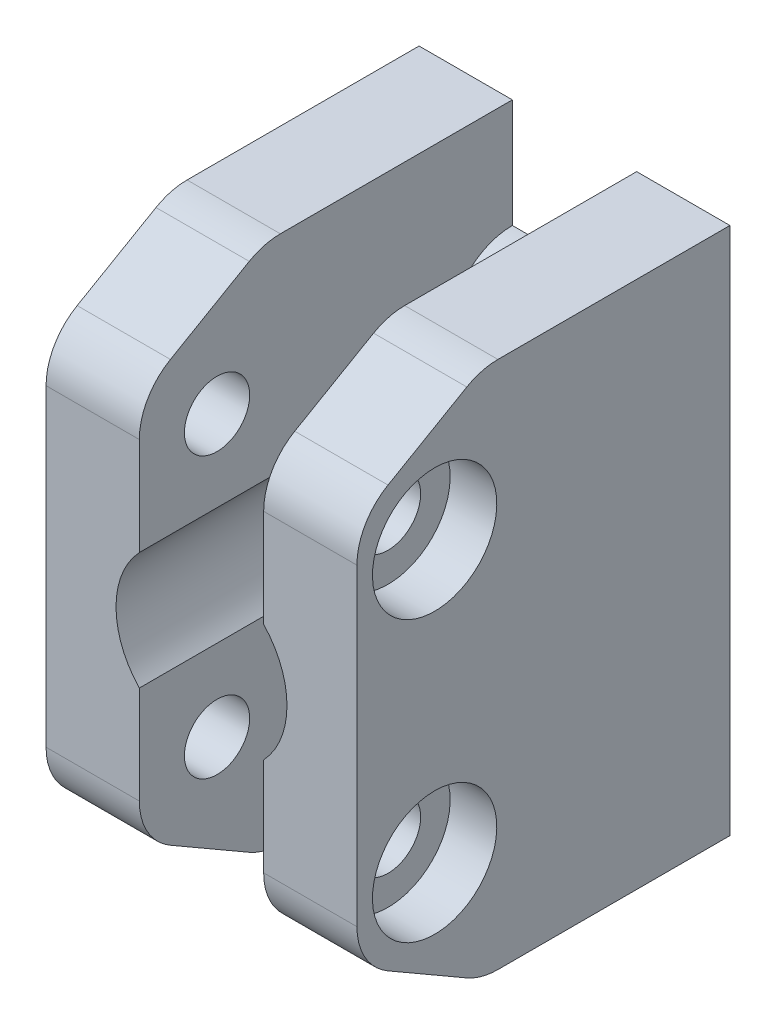
from build123d import *
from OCP.BRepFilletAPI import BRepFilletAPI_MakeChamfer

# Parameters (mm, degrees)
ESQUISSE1_W             = 20
ESQUISSE1_H             = 34
BOSS_EXTRU_1_DEPTH      = 4
ESQUISSE2_W             = 8
ESQUISSE2_H             = 7
ENL_V_MAT_EXTRU_1_DEPTH = 21.124611797
CONG_1_R                = 4
ESQUISSE3_W             = 6
ESQUISSE3_H             = 34
BOSS_EXTRU_2_DEPTH      = 20
ESQUISSE4_R             = 2.1
ENL_V_MAT_EXTRU_2_DEPTH = 36.566838488
CHANFREIN1_SIZE         = 8
CHANFREIN1_SIZE2        = 4.618802154
CONG_2_R                = 4
ESQUISSE5_R             = 3.2
ENL_V_MAT_EXTRU_3_DEPTH = 29.08914381
ESQUISSE6_R             = 5.5
ENL_V_MAT_EXTRU_4_DEPTH = 29.08914381
ESQUISSE7_R             = 4
ENL_V_MAT_EXTRU_5_DEPTH = 3


with BuildPart() as part:
    # Esquisse1 → Boss.-Extru.1 (new body)
    with BuildSketch(Plane.XY):
        Rectangle(ESQUISSE1_W, ESQUISSE1_H)
    extrude(amount=BOSS_EXTRU_1_DEPTH)

    # Esquisse2 → Enlèv. mat.-Extru.1 (cut, through all)
    with BuildSketch(Plane.XY.offset(4)):
        with Locations((0, 13.5)):
            Rectangle(ESQUISSE2_W, ESQUISSE2_H)
        with Locations((0, -13.5)):
            Rectangle(ESQUISSE2_W, ESQUISSE2_H)
    extrude(amount=-ENL_V_MAT_EXTRU_1_DEPTH, mode=Mode.SUBTRACT)

    # Congé1
    cong_1_edges = [part.edges().sort_by_distance(p)[0] for p in [
        (0, -10, 4),
        (0, 10, 4),
    ]]
    fillet(cong_1_edges, radius=CONG_1_R - 0.0001)  # a hair under: the kernel refuses the full size

    # Esquisse3 → Boss.-Extru.2 (add)
    with BuildSketch(Plane.XY.offset(4)):
        with Locations((-7, 0)):
            Rectangle(ESQUISSE3_W, ESQUISSE3_H)
        with Locations((7, 0)):
            Rectangle(ESQUISSE3_W, ESQUISSE3_H)
    extrude(amount=BOSS_EXTRU_2_DEPTH)

    # Esquisse4 → Enlèv. mat.-Extru.2 (cut, through all)
    with BuildSketch(Plane(origin=(10, 0, 0), x_dir=(0, 0, -1), z_dir=(1, 0, 0))):
        with Locations(Location((-19, 9, 0), (0, 0, 90))):
            Circle(ESQUISSE4_R)
        with Locations(Location((-19, -9, 0), (0, 0, 90))):
            Circle(ESQUISSE4_R)
    extrude(amount=-ENL_V_MAT_EXTRU_2_DEPTH, mode=Mode.SUBTRACT)

    # Chanfrein1: one chamfer whose edges measure the first distance from different faces: ONE call of the kernel's chamfer builder (chamfer() names one face for all edges)
    chanfrein1_edges_1 = [part.edges().sort_by_distance(p)[0] for p in [
        (-7, -17, 24),
    ]]
    chanfrein1_side_1 = [part.faces().sort_by_distance(p)[0] for p in [
        (-7, -17, 12),
    ]]
    chanfrein1_edges_2 = [part.edges().sort_by_distance(p)[0] for p in [
        (-7, 17, 24),
    ]]
    chanfrein1_side_2 = [part.faces().sort_by_distance(p)[0] for p in [
        (-7, 17, 12),
    ]]
    chanfrein1_edges_3 = [part.edges().sort_by_distance(p)[0] for p in [
        (7, -17, 24),
    ]]
    chanfrein1_side_3 = [part.faces().sort_by_distance(p)[0] for p in [
        (7, -17, 12),
    ]]
    chanfrein1_edges_4 = [part.edges().sort_by_distance(p)[0] for p in [
        (7, 17, 24),
    ]]
    chanfrein1_side_4 = [part.faces().sort_by_distance(p)[0] for p in [
        (7, 17, 12),
    ]]
    chanfrein1 = BRepFilletAPI_MakeChamfer(part.part.solid().wrapped)
    for e in chanfrein1_edges_1:
        chanfrein1.Add(CHANFREIN1_SIZE, CHANFREIN1_SIZE2, e.wrapped, chanfrein1_side_1[0].wrapped)  # the first distance lies on this face
    for e in chanfrein1_edges_2:
        chanfrein1.Add(CHANFREIN1_SIZE, CHANFREIN1_SIZE2, e.wrapped, chanfrein1_side_2[0].wrapped)  # the first distance lies on this face
    for e in chanfrein1_edges_3:
        chanfrein1.Add(CHANFREIN1_SIZE, CHANFREIN1_SIZE2, e.wrapped, chanfrein1_side_3[0].wrapped)  # the first distance lies on this face
    for e in chanfrein1_edges_4:
        chanfrein1.Add(CHANFREIN1_SIZE, CHANFREIN1_SIZE2, e.wrapped, chanfrein1_side_4[0].wrapped)  # the first distance lies on this face
    add(Compound.cast(chanfrein1.Shape()), mode=Mode.REPLACE)

    # Congé2
    cong_2_edges = [part.edges().sort_by_distance(p)[0] for p in [
        (-7, 12.381197846, 24),
        (-7, -12.381197846, 24),
        (-7, -17, 16),
        (7, 12.381197846, 24),
        (7, -12.381197846, 24),
        (7, -17, 16),
        (-7, 17, 16),
        (7, 17, 16),
    ]]
    fillet(cong_2_edges, radius=CONG_2_R)

    # Esquisse5 → Enlèv. mat.-Extru.3 (cut, through all)
    with BuildSketch(Plane.XY.offset(4)):
        Circle(ESQUISSE5_R)
    extrude(amount=-ENL_V_MAT_EXTRU_3_DEPTH, mode=Mode.SUBTRACT)

    # Esquisse6 → Enlèv. mat.-Extru.4 (cut, through all)
    with BuildSketch(Plane.XY.offset(4)):
        Circle(ESQUISSE6_R)
    extrude(amount=ENL_V_MAT_EXTRU_4_DEPTH, mode=Mode.SUBTRACT)

    # Esquisse7 → Enlèv. mat.-Extru.5 (cut)
    with BuildSketch(Plane(origin=(10, 0, 0), x_dir=(0, 0, -1), z_dir=(1, 0, 0))):
        with Locations(Location((-19, 9, 0), (0, 0, 90))):
            Circle(ESQUISSE7_R)
        with Locations(Location((-19, -9, 0), (0, 0, 90))):
            Circle(ESQUISSE7_R)
    extrude(amount=-ENL_V_MAT_EXTRU_5_DEPTH, mode=Mode.SUBTRACT)


solid = part.part
